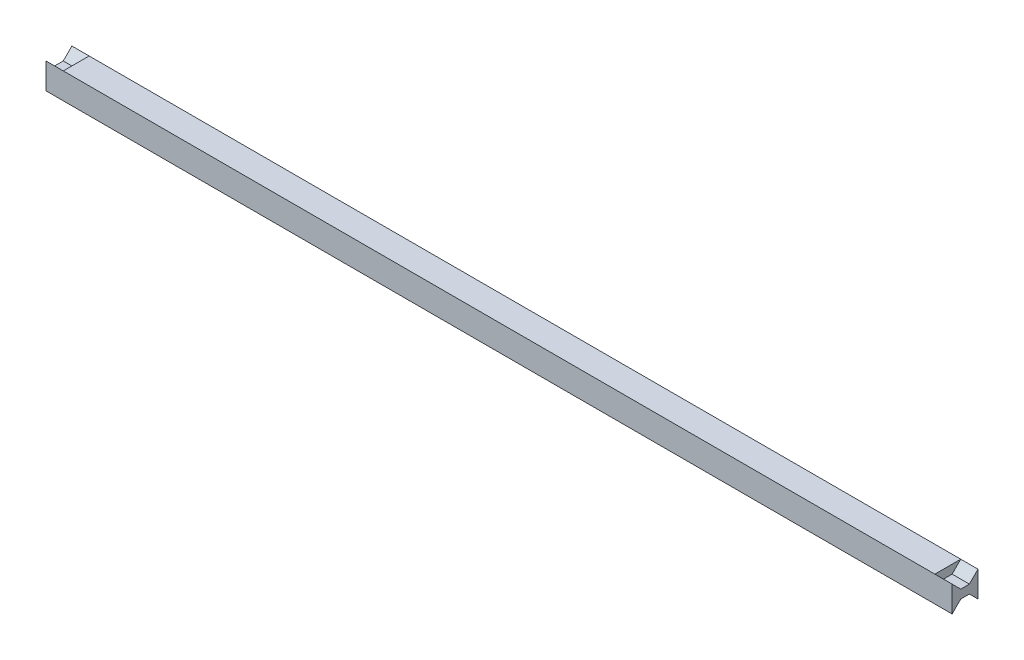
from build123d import *

# Parameters (mm, degrees)
SKICA1_W                = 202
SKICA1_H                = 6
P_IDAT_VYSUNUT_M1_DEPTH = 6
P_IDAT_VYSUNUT_M2_DEPTH = 4
P_IDAT_VYSUNUT_M3_DEPTH = 4


with BuildPart() as part:
    # Skica1 → Přidat vysunutím1 (new body)
    with BuildSketch(Plane(origin=(0, 0, 0), x_dir=(1, 0, 0), z_dir=(0, 1, 0))):
        with Locations((101, 3)):
            Rectangle(SKICA1_W, SKICA1_H)
    extrude(amount=P_IDAT_VYSUNUT_M1_DEPTH)

    # Skica2 → Přidat vysunutím2 (add)
    with BuildSketch(Plane.ZY):
        Polygon((-6, 6), (-6, 0), (-4, 2), (-2, 2), (0, 0), (0, 6), (-2, 4), (-4, 4), align=None)
    extrude(amount=P_IDAT_VYSUNUT_M2_DEPTH)

    # Skica3 → Přidat vysunutím3 (add)
    with BuildSketch(Plane(origin=(202, 0, 0), x_dir=(0, 0, -1), z_dir=(1, 0, 0))):
        Polygon((0, 6), (0, 0), (2, 2), (4, 2), (6, 0), (6, 6), (4, 4), (2, 4), align=None)
    extrude(amount=P_IDAT_VYSUNUT_M3_DEPTH)


solid = part.part
